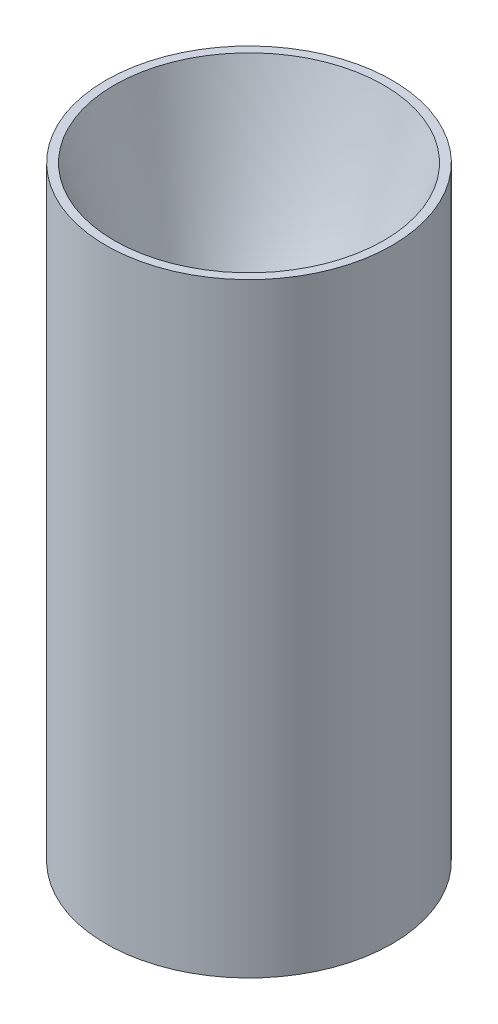
from build123d import *

# Parameters (mm, degrees)
CIRPATTERN1_COUNT = 8


with BuildPart() as part:
    # Sketch1 → Revolve2 (revolve)
    with BuildSketch(Plane.XY):
        with BuildLine():
            Line((71.727523602, 109.927507641), (76.194467874, 109.927507641))
            Line((76.194467874, 109.927507641), (76.194467874, -212.127513222))
            Line((76.194467874, -212.127513222), (53.881527661, -212.127513222))
            Line((53.881527661, -212.127513222), (53.881527661, -59.727513222))
            add(Edge.make_bspline(
                [(53.881527661, -59.727513222), (53.88152643, -59.656983156), (53.880997287, -59.515406102), (53.878621437, -59.181564616), (53.872296838, -58.904795492), (53.862811351, -58.532567487), (53.850168453, -58.212837621), (53.830417626, -57.781594442), (53.800405285, -57.280959899), (53.756193121, -56.687998165), (53.677288452, -55.848480365), (53.577426861, -55.00816586), (53.456675786, -54.17243543), (53.286810822, -53.172425239), (53.092064187, -52.177442821), (52.86637512, -51.188539083), (52.610014224, -50.207489038), (52.32928934, -49.23307774), (52.024348739, -48.265969223), (51.633537831, -47.149135067), (51.139520361, -45.890408405), (50.598733752, -44.650968803), (50.012060927, -43.432701525), (49.38012023, -42.237093238), (48.704125229, -41.066154878), (47.984475519, -39.920972657), (47.223102138, -38.804076239), (46.51986906, -37.851451785), (45.893537937, -37.055672122), (45.35281768, -36.403381282), (44.915126948, -35.894247632), (44.514776189, -35.446992657), (44.181457503, -35.084631185), (43.873924624, -34.760340151), (43.674072406, -34.55154945), (43.444392072, -34.318516287), (43.343783151, -34.217162055), (43.293911001, -34.167289665)],
                knots=[0.082637729, 0.082637729, 0.082637729, 0.082637729, 0.082637729, 0.092574926, 0.102512123, 0.11244932, 0.122386517, 0.132323714, 0.142260911, 0.162135305, 0.182009699, 0.201884093, 0.24163288, 0.261507274, 0.281381668, 0.321130456, 0.360879243, 0.380753637, 0.400628031, 0.440376819, 0.480125606, 0.519874394, 0.559623181, 0.599371969, 0.639120757, 0.678869544, 0.718618332, 0.75836712, 0.798115907, 0.817990301, 0.837864695, 0.857739089, 0.877613483, 0.88755068, 0.897487877, 0.907425074, 0.91736227, 0.91736227, 0.91736227, 0.91736227, 0.91736227], degree=4))
            Line((43.293911001, -34.167289665), (34.686282803, -25.559661468))
            add(Edge.make_bspline(
                [(24.099067874, 0.000160672), (24.099069105, -0.070367974), (24.099598252, -0.213423517), (24.101973937, -0.543022243), (24.108298331, -0.823999723), (24.117783452, -1.194661398), (24.130425744, -1.513274385), (24.146225968, -1.86177893), (24.165181227, -2.193546199), (24.192818841, -2.617908727), (24.232287047, -3.121873274), (24.303299707, -3.879818002), (24.423126678, -4.886289716), (24.599486044, -6.056550088), (24.850885233, -7.385005743), (25.151795313, -8.703413844), (25.501770623, -10.009476539), (25.900360983, -11.301658928), (26.346945392, -12.577938667), (26.841003323, -13.836726817), (27.381673122, -15.076036463), (27.968479387, -16.294449129), (28.600139398, -17.489778131), (29.276532396, -18.661127096), (29.995445102, -19.805582737), (30.758021999, -20.923699417), (31.459167193, -21.874251104), (32.088736123, -22.673284825), (32.624128416, -23.320261484), (33.072255768, -23.839844364), (33.508450026, -24.329655594), (33.935826121, -24.788323739), (34.24555864, -25.11370766), (34.536859958, -25.409488397), (34.636412426, -25.509789283), (34.686282803, -25.559661468)],
                knots=[0.082637729, 0.082637729, 0.082637729, 0.082637729, 0.082637729, 0.092574926, 0.102512123, 0.11244932, 0.122386517, 0.132323714, 0.142260911, 0.152198108, 0.162135305, 0.182009699, 0.201884093, 0.24163288, 0.281381668, 0.321130456, 0.360879243, 0.400628031, 0.440376819, 0.480125606, 0.519874394, 0.559623181, 0.599371969, 0.639120757, 0.678869544, 0.718618332, 0.75836712, 0.798115907, 0.817990301, 0.837864695, 0.857739089, 0.877613483, 0.897487877, 0.907425074, 0.91736227, 0.91736227, 0.91736227, 0.91736227, 0.91736227], degree=4))
            add(Edge.make_bspline(
                [(24.099067874, 0.000160672), (24.0990685, 0.036053324), (24.099606331, 0.110274362), (24.102023723, 0.267801742), (24.108461568, 0.427224789), (24.120533599, 0.646924939), (24.141435087, 0.901594), (24.175184719, 1.202697945), (24.226499305, 1.54221117), (24.290543701, 1.881157449), (24.367141601, 2.216515092), (24.456323571, 2.549400093), (24.557741413, 2.878253317), (24.671619071, 3.203507713), (24.797196771, 3.523787829), (24.935285977, 3.839827405), (25.084070301, 4.149442857), (25.246012222, 4.454943795), (25.416488505, 4.751462248), (25.602514721, 5.045864533), (25.79178827, 5.325679608), (26.004405474, 5.610888215), (26.178876374, 5.83307432), (26.366345756, 6.050112309), (26.504555248, 6.208802318), (26.67044207, 6.382282451), (26.744520261, 6.458639514), (26.795279203, 6.509400323)],
                knots=[0.082568816, 0.082568816, 0.082568816, 0.082568816, 0.082568816, 0.102426634, 0.122284453, 0.142142271, 0.162000089, 0.201715725, 0.241431362, 0.281146998, 0.320862634, 0.360578271, 0.400293907, 0.440009544, 0.47972518, 0.519440816, 0.559156453, 0.598872089, 0.638587725, 0.678303362, 0.718018998, 0.757734635, 0.797450271, 0.837165907, 0.857023726, 0.876881544, 0.91659718, 0.91659718, 0.91659718, 0.91659718, 0.91659718], degree=4))
            add(Edge.make_bspline(
                [(26.795279203, 6.509400323), (49.261401403, 34.636114842), (71.727523602, 109.927507641)],
                knots=[0, 0, 0, 1, 1, 1], degree=2))
        make_face()
    revolve(axis=Axis((-0.005532126, 165.815985114, 0), (0, -1, 0)))

    # Sketch4 → 3/8-24 Tapped Hole1 (revolve, cut)
    with BuildSketch(Plane(origin=(65.2, -212.127513222, 0), x_dir=(0, 0, -1), z_dir=(1, 0, 0))):
        Polygon((0, 0), (0, 27.533468714), (4.2164, 25), (4.2164, 0), align=None)
    f_3_8_24_tapped_hole1 = revolve(axis=Axis((65.2, -218.477513222, 0), (0, 1, 0)), mode=Mode.SUBTRACT)

    # CirPattern1: 3/8-24 Tapped Hole1 ×8 about axis
    cirpattern1_axis = Axis((0, -228.487022387, 0), (-1.634718801334702e-05, 0.9999999998663848, 0))
    for i in range(1, CIRPATTERN1_COUNT):
        add(f_3_8_24_tapped_hole1.rotate(cirpattern1_axis, i * 360 / CIRPATTERN1_COUNT), mode=Mode.SUBTRACT)


solid = part.part
